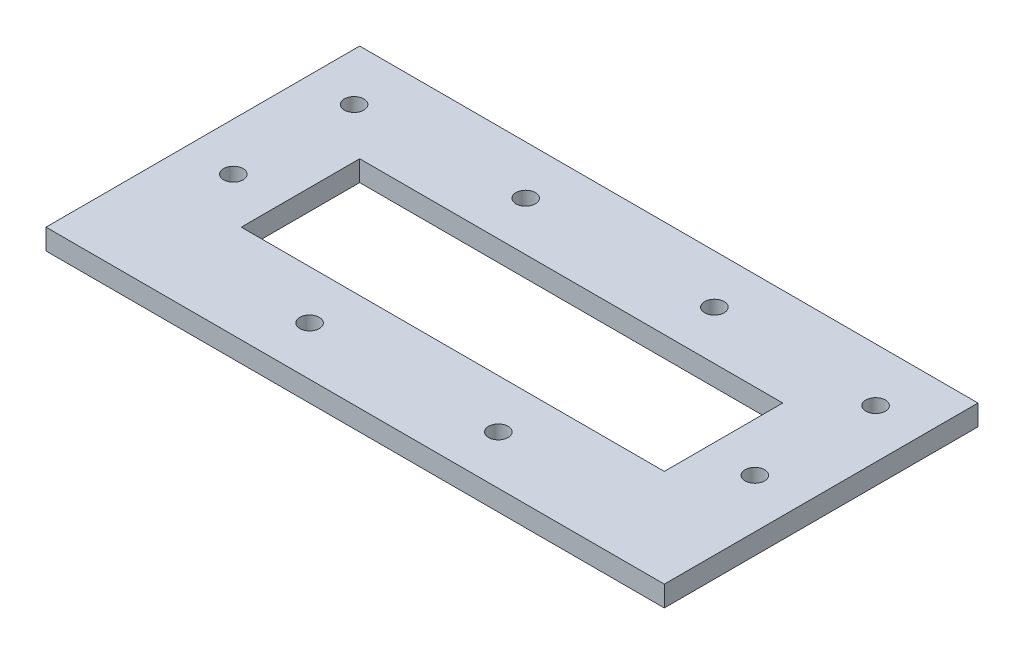
from build123d import *

# Parameters (mm, degrees)
SKETCH2_W           = 94.999999992
SKETCH2_H           = 48.197360298
SKETCH2_R           = 1.5
SKETCH2_W_2         = 64.999999992
SKETCH2_H_2         = 18.197360298
BOSS_EXTRUDE2_DEPTH = 3.175


with BuildPart() as part:
    # Sketch2 → Boss-Extrude2 (new body)
    with BuildSketch(Plane(origin=(0, 0, 0), x_dir=(1, 0, 0), z_dir=(0, 1, 0))):
        Rectangle(SKETCH2_W, SKETCH2_H)
        with Locations((-14.499999996, 16.598680149)):
            Circle(SKETCH2_R, mode=Mode.SUBTRACT)
        with Locations((14.499999996, 16.598680149)):
            Circle(SKETCH2_R, mode=Mode.SUBTRACT)
        with Locations((-40.148974228, 15.881761887)):
            Circle(SKETCH2_R, mode=Mode.SUBTRACT)
        with Locations((-40.148974228, -2.662696697)):
            Circle(SKETCH2_R, mode=Mode.SUBTRACT)
        with Locations((39.978852734, 15.881761887)):
            Circle(SKETCH2_R, mode=Mode.SUBTRACT)
        with Locations((39.978852734, -2.662696697)):
            Circle(SKETCH2_R, mode=Mode.SUBTRACT)
        with Locations((-14.499999996, -16.598680149)):
            Circle(SKETCH2_R, mode=Mode.SUBTRACT)
        with Locations((14.499999996, -16.598680149)):
            Circle(SKETCH2_R, mode=Mode.SUBTRACT)
        Rectangle(SKETCH2_W_2, SKETCH2_H_2, mode=Mode.SUBTRACT)
    extrude(amount=BOSS_EXTRUDE2_DEPTH)


solid = part.part
